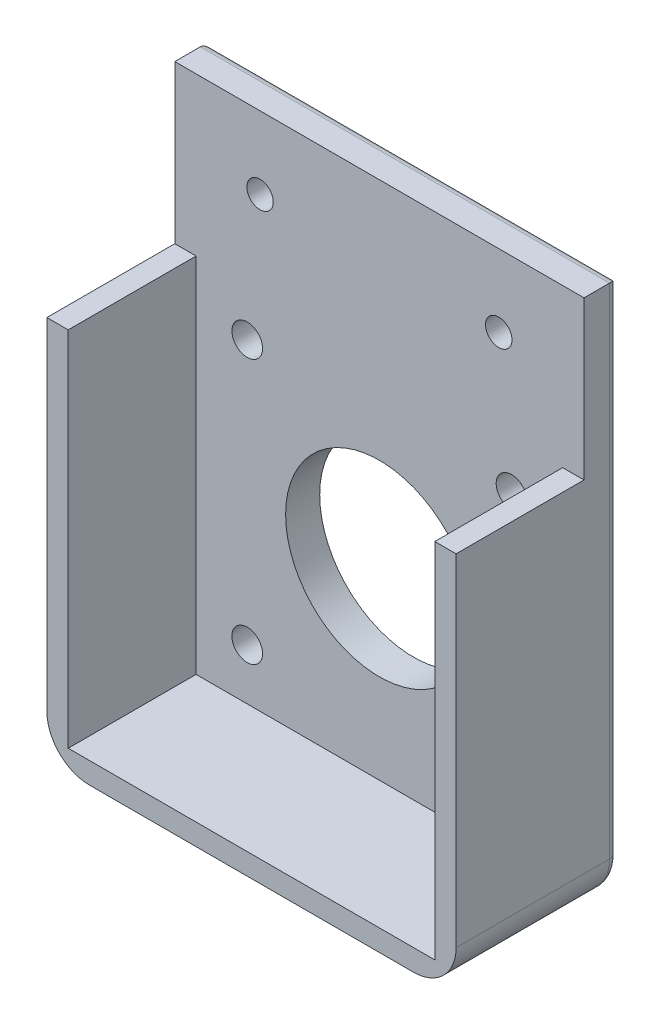
from build123d import *

# Parameters (mm, degrees)
ESQUISSE1_W                     = 48
ESQUISSE1_H                     = 63.5
BOSS_EXTRU_1_DEPTH              = 4
CONG_1_R                        = 1
DIAM_TRE_DU_PER_AGE_22_0_22_1_D = 22
D_GAGEMENT_M31_D                = 3.6
R_P_TITION_LIN_AIRE1_COUNT      = 2
R_P_TITION_LIN_AIRE1_PITCH      = 31
R_P_TITION_LIN_AIRE2_COUNT      = 2
R_P_TITION_LIN_AIRE2_PITCH      = 31
R_P_TITION_LIN_AIRE2_COPY_1_D   = 3.6
D_GAGEMENT_M2_54_D              = 3.1
ESQUISSE19_W                    = 18.410058986
ESQUISSE19_H                    = 2.5
ESQUISSE19_W_2                  = 24.589941014
BOSS_EXTRU_2_DEPTH              = 15
CONG_2_R                        = 5


with BuildPart() as part:
    # Esquisse1 → Boss.-Extru.1 (new body)
    with BuildSketch(Plane.XY):
        with Locations((9.64559387, 37.224137931)):
            Rectangle(ESQUISSE1_W, ESQUISSE1_H)
    extrude(amount=BOSS_EXTRU_1_DEPTH)

    # Congé1
    cong_1_edges = [part.edges().sort_by_distance(p)[0] for p in [
        (9.64559387, 68.974137931, 0),
        (33.64559387, 37.224137931, 0),
        (9.64559387, 5.474137931, 0),
        (-14.35440613, 37.224137931, 0),
    ]]
    fillet(cong_1_edges, radius=CONG_1_R)

    # Diamètre du perçage Ø22.0 (22)1 (through all)
    with Locations(Plane.XY.offset(4)):
        with Locations((9.64559387, 29.474137931)):
            Hole(DIAM_TRE_DU_PER_AGE_22_0_22_1_D / 2)

    # Dégagement M31 (through all)
    with Locations(Plane.XY.offset(4)):
        with Locations((-5.85440613, 44.974137931)):
            d_gagement_m31 = Hole(D_GAGEMENT_M31_D / 2)

    # Répétition linéaire1: Dégagement M31 ×2
    with Locations(*[(i * R_P_TITION_LIN_AIRE1_PITCH, 0, 0) for i in range(1, R_P_TITION_LIN_AIRE1_COUNT)]):
        add(d_gagement_m31, mode=Mode.SUBTRACT)

    # Répétition linéaire2: Dégagement M31 ×2
    with Locations(*[(0, -i * R_P_TITION_LIN_AIRE2_PITCH, 0) for i in range(1, R_P_TITION_LIN_AIRE2_COUNT)]):
        add(d_gagement_m31, mode=Mode.SUBTRACT)

    # Répétition linéaire2 copy 1 (through all)
    with Locations(Plane(origin=(31, -31, 4), x_dir=(1, 0, 0), z_dir=(0, 0, 1))):
        with Locations((-5.85440613, 44.974137931)):
            Hole(R_P_TITION_LIN_AIRE2_COPY_1_D / 2)

    # Dégagement M2.54 (through all)
    with Locations(Plane.XY.offset(4)):
        with Locations((-4.35440613, 60.474137931), (23.64559387, 60.474137931)):
            Hole(D_GAGEMENT_M2_54_D / 2)

    # Esquisse19 → Boss.-Extru.2 (add)
    with BuildSketch(Plane.XY.offset(4)):
        Polygon((-14.35440613, 50.474137931), (-14.35440613, 5.474137931), (-11.85440613, 5.474137931), (-11.85440613, 7.974137931), (-11.85440613, 50.474137931), align=None)
        with Locations((-2.649376637, 6.724137931)):
            Rectangle(ESQUISSE19_W, ESQUISSE19_H)
        with Locations((18.850623363, 6.724137931)):
            Rectangle(ESQUISSE19_W_2, ESQUISSE19_H)
        Polygon((31.14559387, 7.974137931), (31.14559387, 5.474137931), (33.64559387, 5.474137931), (33.64559387, 50.474137931), (31.14559387, 50.474137931), align=None)
    extrude(amount=BOSS_EXTRU_2_DEPTH)

    # Congé2
    # the kernel refuses this fillet: 5 mm, written as the material it takes off along each edge
    with BuildSketch(Plane(origin=(-9.35440613, 10.474137931, 0), x_dir=(0, -1, 0), z_dir=(1, 0, 0))) as cong_2_piece_1:
        with BuildLine():
            CenterArc((4, -1), 1, 0, 90)
            Line((5, -1), (5, 0))
            Line((5, 0), (4, 0))
        make_face()
    revolve(axis=Axis((-9.35440613, 10.474137931, 0), (0, 0, -1)), revolution_arc=90, mode=Mode.SUBTRACT)
    with BuildSketch(Plane(origin=(28.64559387, 10.474137931, 0), x_dir=(1, 0, 0), z_dir=(0, 1, 0))) as cong_2_piece_2:
        with BuildLine():
            CenterArc((4, -1), 1, 0, 90)
            Line((5, -1), (5, 0))
            Line((5, 0), (4, 0))
        make_face()
    revolve(axis=Axis((28.64559387, 10.474137931, 0), (0, 0, -1)), revolution_arc=90, mode=Mode.SUBTRACT)
    with BuildSketch(Plane(origin=(33.64559387, 5.474137931, 31.5), x_dir=(0, 1, 0), z_dir=(0, 0, -1))) as cong_2_piece_3:
        with BuildLine():
            CenterArc((CONG_2_R, -CONG_2_R), CONG_2_R, 90, 90)
            Line((0, -CONG_2_R), (0, 0))
            Line((0, 0), (CONG_2_R, 0))
        make_face()
    extrude(amount=31.5, mode=Mode.SUBTRACT)
    with BuildSketch(Plane(origin=(-14.35440613, 5.474137931, 0), x_dir=(1, 0, 0), z_dir=(0, 0, 1))) as cong_2_piece_4:
        with BuildLine():
            CenterArc((CONG_2_R, CONG_2_R), CONG_2_R, 180, 90)
            Line((0, CONG_2_R), (0, 0))
            Line((0, 0), (CONG_2_R, 0))
        make_face()
    extrude(amount=31.5, mode=Mode.SUBTRACT)


solid = part.part
